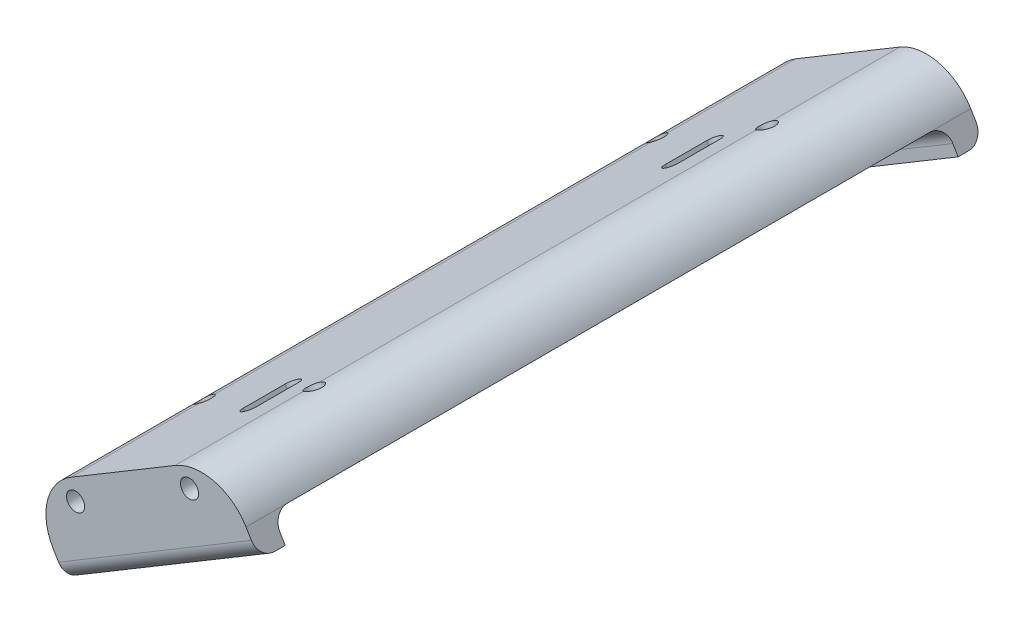
from build123d import *
from build123d.topology import SkipClean

# Parameters (mm, degrees)
EXTRUDE_1_DEPTH     = 140
SKETCH_3_W          = 130
SKETCH_3_H          = 43.521600754
CUT_EXTRUDE_1_DEPTH = 140
FILLET_1_R          = 3
SKETCH_6_R          = 1.65
CUT_EXTRUDE_3_DEPTH = 140.785766084
CUT_EXTRUDE_5_DEPTH = 140.785766213


with BuildPart() as part:
    # 草图2 → 凸台-拉伸1 (new body)
    with BuildSketch(Plane(origin=(-32.059130177, 54.940089383, -3.740494777), x_dir=(1, 0, 0), z_dir=(0, 0, 1))):
        with BuildLine():
            Line((4.084456485, 29.300983511), (1.51781441, 33.591944763))
            ThreePointArc((1.51781441, 33.591944763), (-4.625552527, 38.156776242), (-12.197392242, 37.040583116))
            Line((-12.197392242, 37.040583116), (-32.279090898, 25.028698207))
            ThreePointArc((-32.279090898, 25.028698207), (-36.843922378, 18.88533127), (-35.727729252, 11.313491555))
            Line((-35.727729252, 11.313491555), (-33.161087177, 7.022530303))
            Line((-33.161087177, 7.022530303), (4.084456485, 29.300983511))
        make_face()
        with BuildLine():
            ThreePointArc((-29.724378226, 21.835560144), (-29.682535204, 21.618009697), (-29.668512623, 21.396916046))
            ThreePointArc((-29.668512623, 21.396916046), (-31.307806965, 19.650421197), (-33.15450606, 21.175948205))
            ThreePointArc((-33.15450606, 21.175948205), (-31.74898202, 23.115429932), (-29.724378226, 21.835560144))
        make_face(mode=Mode.SUBTRACT)
        with BuildLine():
            ThreePointArc((-8.388585267, 35.989266702), (-7.848745837, 35.365776548), (-7.654412528, 34.564277236))
            ThreePointArc((-7.654412528, 34.564277236), (-8.703048059, 32.960971937), (-10.59222725, 33.279132814))
            ThreePointArc((-10.59222725, 33.279132814), (-10.762205348, 35.668314671), (-8.388585267, 35.989266702))
        make_face(mode=Mode.SUBTRACT)
    extrude(amount=EXTRUDE_1_DEPTH)

    # 草图3 → 切除-拉伸1 (cut)
    with BuildSketch(Plane(origin=(16.507918588, 9.874225362, 0), x_dir=(0, 0, -1), z_dir=(0.8581922502722598, 0.5133284149281387, 0))):
        with Locations((-66.259505223, 69.89443044)):
            Rectangle(SKETCH_3_W, SKETCH_3_H)
    extrude(amount=-CUT_EXTRUDE_1_DEPTH, mode=Mode.SUBTRACT)

    # 圆角1
    fillet_1_edges = [part.edges().sort_by_distance(p)[0] for p in [
        (-49.164087597, 77.392807541, 1.259505223),
        (-49.164087597, 77.392807541, 131.259505223),
        (-46.597445523, 73.10184629, 136.259505223),
        (-46.597445523, 73.10184629, -3.740494777),
    ]]
    fillet(fillet_1_edges, radius=FILLET_1_R)

    # 草图6 → 切除-拉伸3 (cut, through all)
    with SkipClean():  # the faces are left unmerged after this step: merging them gives an invalid solid
        with BuildSketch(Plane(origin=(-44.48259228, 74.366847532, 0), x_dir=(0.8581922502720689, 0.5133284149284576, 0), z_dir=(0.5133284149284575, -0.8581922502720688, 0))):
            with Locations((-14.817529772, 110)):
                Circle(SKETCH_6_R)
            with Locations((9.885688254, 110)):
                Circle(SKETCH_6_R)
            with Locations((9.885688254, 22.519010445)):
                Circle(SKETCH_6_R)
            with Locations((-14.817529772, 22.519010445)):
                Circle(SKETCH_6_R)
        extrude(amount=-CUT_EXTRUDE_3_DEPTH, mode=Mode.SUBTRACT)

    # 草图7 → 切除-拉伸5 (cut, through all)
    with SkipClean():  # the faces are left unmerged after this step: merging them gives an invalid solid
        with BuildSketch(Plane(origin=(-44.48259228, 74.366847532, 0), x_dir=(0.8581922502720689, 0.5133284149284576, 0), z_dir=(0.5133284149284575, -0.8581922502720688, 0))):
            with BuildLine():
                Line((0.565042564, 115.612915439), (0.565042564, 107.612915439))
                ThreePointArc((0.565042564, 107.612915439), (2.065042564, 106.112915439), (3.565042564, 107.612915439))
                Line((3.565042564, 107.612915439), (3.565042564, 115.612915439))
                ThreePointArc((3.565042564, 115.612915439), (2.065042564, 117.112915439), (0.565042564, 115.612915439))
            make_face()
            with BuildLine():
                Line((0.565042564, 34.118509408), (0.565042564, 26.118509408))
                ThreePointArc((0.565042564, 26.118509408), (2.065042564, 24.618509408), (3.565042564, 26.118509408))
                Line((3.565042564, 26.118509408), (3.565042564, 34.118509408))
                ThreePointArc((3.565042564, 34.118509408), (2.065042564, 35.618509408), (0.565042564, 34.118509408))
            make_face()
        extrude(amount=-CUT_EXTRUDE_5_DEPTH, mode=Mode.SUBTRACT)


solid = part.part
